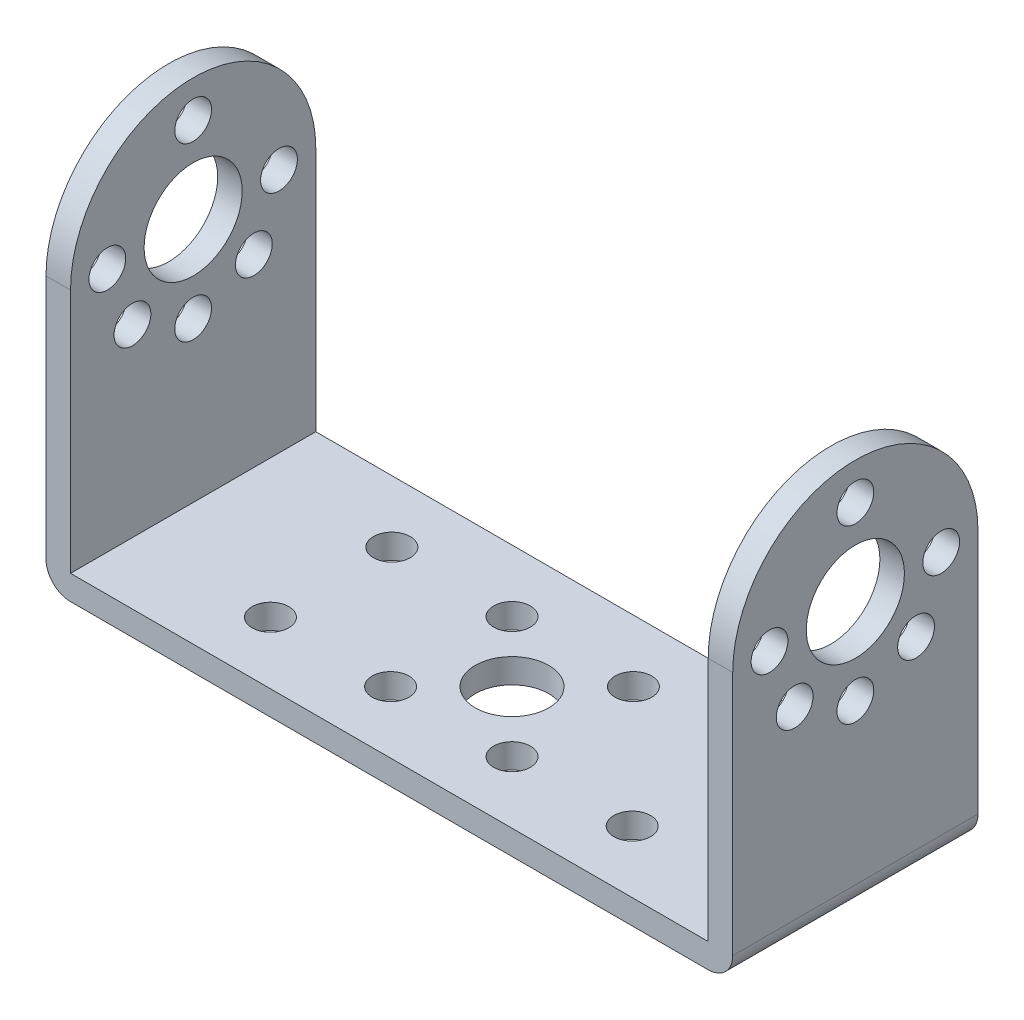
from build123d import *

# Parameters (mm, degrees)
SKETCH_1_W                = 52
SKETCH_1_H                = 20
SKETCH_1_R                = 3
SKETCH_1_R_2              = 1.5
EXTRUDE_1_DEPTH           = 2
SKETCH_2_W                = 2
SKETCH_2_H                = 20
EXTRUDE_2_DEPTH           = 32
CUT_EXTRUDE_START         = -28
CUT_EXTRUDE_1_OUTLINE_R   = 1.5
CUT_EXTRUDE_1_OUTLINE_R_2 = 4
CUT_EXTRUDE_1_DEPTH       = 56
FILLET_1_R                = 2


# Read off the part's stored shape, not the designer's step: 切除-拉伸1
with BuildPart() as part:
    # 草图1 → 凸台-拉伸1 (new body)
    with BuildSketch(Plane(origin=(0, 0, 0), x_dir=(1, 0, 0), z_dir=(0, 1, 0))):
        Rectangle(SKETCH_1_W, SKETCH_1_H)
        with Locations(Location((0, 0, 0), (0, 0, 270))):
            Circle(SKETCH_1_R, mode=Mode.SUBTRACT)
        with Locations(Location((-4.949747468, -4.949747468, 0), (0, 0, 270))):
            Circle(SKETCH_1_R_2, mode=Mode.SUBTRACT)
        with Locations(Location((-4.949747468, 4.949747468, 0), (0, 0, 270))):
            Circle(SKETCH_1_R_2, mode=Mode.SUBTRACT)
        with Locations(Location((4.949747468, 4.949747468, 0), (0, 0, 270))):
            Circle(SKETCH_1_R_2, mode=Mode.SUBTRACT)
        with Locations(Location((4.949747468, -4.949747468, 0), (0, 0, 270))):
            Circle(SKETCH_1_R_2, mode=Mode.SUBTRACT)
        with Locations(Location((14.75, -4.949747468, 0), (0, 0, 270))):
            Circle(SKETCH_1_R_2, mode=Mode.SUBTRACT)
        with Locations(Location((14.75, 4.949747468, 0), (0, 0, 270))):
            Circle(SKETCH_1_R_2, mode=Mode.SUBTRACT)
        with Locations(Location((-14.75, -4.949747468, 0), (0, 0, 90))):
            Circle(SKETCH_1_R_2, mode=Mode.SUBTRACT)
        with Locations(Location((-14.75, 4.949747468, 0), (0, 0, 90))):
            Circle(SKETCH_1_R_2, mode=Mode.SUBTRACT)
    extrude(amount=EXTRUDE_1_DEPTH)

    # 草图2 → 凸台-拉伸2 (add)
    with BuildSketch(Plane(origin=(0, 0, 0), x_dir=(1, 0, 0), z_dir=(0, 1, 0))):
        with Locations((27, 0)):
            Rectangle(SKETCH_2_W, SKETCH_2_H)
        with Locations((-27, 0)):
            Rectangle(SKETCH_2_W, SKETCH_2_H)
    extrude(amount=EXTRUDE_2_DEPTH)

    # 切除-拉伸1 outline → 切除-拉伸1 (cut)
    with BuildSketch(Plane(origin=(0, 0, 0), x_dir=(0, 0, -1), z_dir=(1, 0, 0)).offset(CUT_EXTRUDE_START)):
        with BuildLine():
            ThreePointArc((-10, 22), (-7.071067812, 29.071067812), (0, 32))
            Line((0, 32), (-10, 32))
            Line((-10, 32), (-10, 22))
        make_face()
        with BuildLine():
            ThreePointArc((0, 32), (7.071067812, 29.071067812), (10, 22))
            Line((10, 22), (10, 32))
            Line((10, 32), (0, 32))
        make_face()
        with Locations((0, 29)):
            Circle(CUT_EXTRUDE_1_OUTLINE_R)
        with Locations((0, 15)):
            Circle(CUT_EXTRUDE_1_OUTLINE_R)
        with Locations((0, 22)):
            Circle(CUT_EXTRUDE_1_OUTLINE_R_2)
        with Locations((-7, 22)):
            Circle(CUT_EXTRUDE_1_OUTLINE_R)
        with Locations((7, 22)):
            Circle(CUT_EXTRUDE_1_OUTLINE_R)
        with Locations((-4.949747468, 17.050252532)):
            Circle(CUT_EXTRUDE_1_OUTLINE_R)
        with Locations((4.949747468, 17.050252532)):
            Circle(CUT_EXTRUDE_1_OUTLINE_R)
    extrude(amount=CUT_EXTRUDE_1_DEPTH, mode=Mode.SUBTRACT)

    # 圆角1
    fillet_1_edges = [part.edges().sort_by_distance(p)[0] for p in [
        (28, 0, 0),
        (-28, 0, 0),
    ]]
    fillet(fillet_1_edges, radius=FILLET_1_R)


solid = part.part
